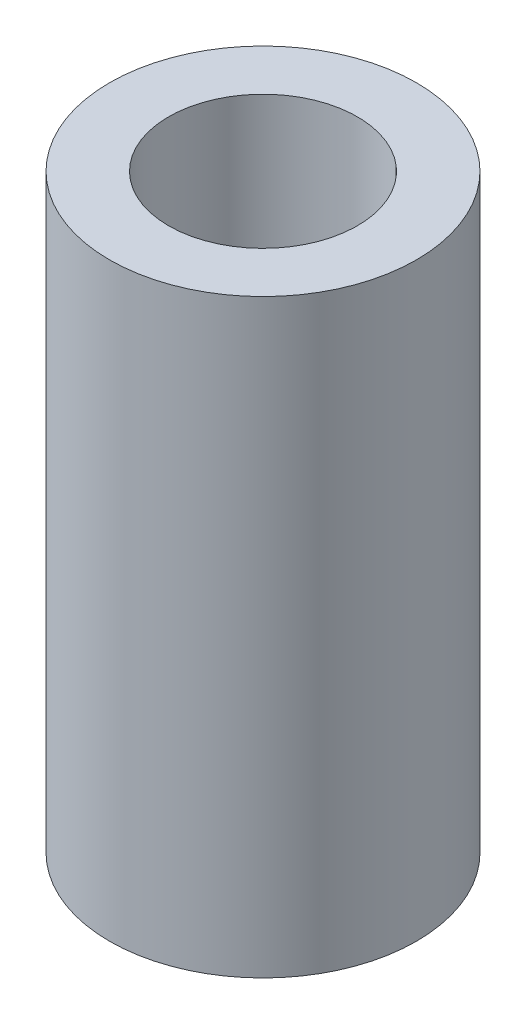
from build123d import *

# Parameters (mm, degrees)
SKETCH_1_R      = 6.5
SKETCH_1_R_2    = 4
EXTRUDE_1_DEPTH = 25


with BuildPart() as part:
    # Эскиз1 → Бобышка-Вытянуть1 (new body)
    with BuildSketch(Plane(origin=(0, 0, 0), x_dir=(1, 0, 0), z_dir=(0, 1, 0))):
        Circle(SKETCH_1_R)
        Circle(SKETCH_1_R_2, mode=Mode.SUBTRACT)
    extrude(amount=EXTRUDE_1_DEPTH)


solid = part.part
